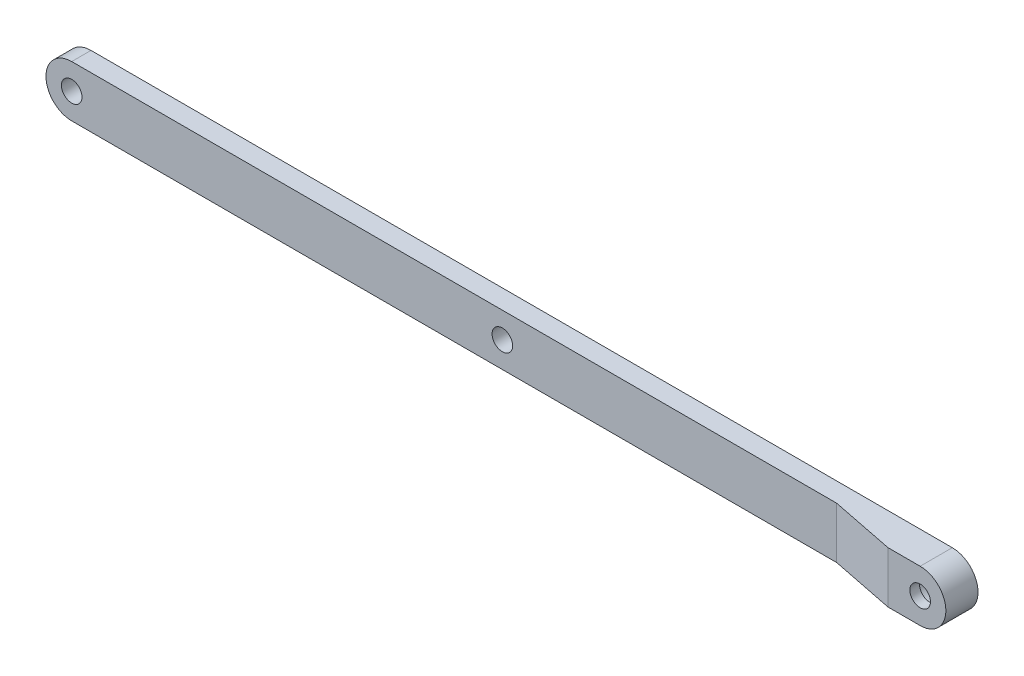
from build123d import *

# Parameters (mm, degrees)
SKETCH_1_R          = 2.75
SKETCH_1_R_2        = 1.6
EXTRUDE_1_DEPTH     = 5
EXTRUDE_START       = -1.5
SKETCH_2_R          = 2.75
SKETCH_2_R_2        = 1.6
EXTRUDE_2_DEPTH     = 1.5
SKETCH_3_W          = 127
SKETCH_3_H          = 8
CUT_EXTRUDE_1_DEPTH = 2
CHAMFER_1_SIZE2     = 2
CHAMFER_1_SIZE      = 10


with BuildPart() as part:
    # 草圖1 → 填料-伸長1 (new body)
    with BuildSketch(Plane.XY):
        with BuildLine():
            Line((-53.111291809, 4), (80.888708191, 4))
            ThreePointArc((80.888708191, 4), (84.888708191, 0), (80.888708191, -4))
            Line((80.888708191, -4), (-53.111291809, -4))
            ThreePointArc((-53.111291809, -4), (-57.111291809, 0), (-53.111291809, 4))
        make_face()
        with Locations((80.888708191, 0)):
            Circle(SKETCH_1_R, mode=Mode.SUBTRACT)
        with Locations((-53.111291809, 0)):
            Circle(SKETCH_1_R_2, mode=Mode.SUBTRACT)
        with Locations((13.888708191, 0)):
            Circle(SKETCH_1_R_2, mode=Mode.SUBTRACT)
    extrude(amount=EXTRUDE_1_DEPTH)

    # 草圖2 → 填料-伸長2 (add)
    with BuildSketch(Plane.XY.offset(5).offset(EXTRUDE_START)):
        with Locations((80.888708191, 0)):
            Circle(SKETCH_2_R)
        with Locations((80.888708191, 0)):
            Circle(SKETCH_2_R_2, mode=Mode.SUBTRACT)
    extrude(amount=EXTRUDE_2_DEPTH)

    # 草圖3 → 除料-伸長1 (cut)
    with BuildSketch(Plane.XY.offset(5)):
        with Locations((2.388708191, 0)):
            Rectangle(SKETCH_3_W, SKETCH_3_H)
    extrude(amount=-CUT_EXTRUDE_1_DEPTH, mode=Mode.SUBTRACT)

    # 導角1
    chamfer_1_edges = [part.edges().sort_by_distance(p)[0] for p in [
        (65.888708191, 0, 5),
    ]]
    chamfer_1_side = [part.faces().sort_by_distance(p)[0] for p in [
        (65.928708191, 0, 5),
    ]]
    chamfer(chamfer_1_edges, length=CHAMFER_1_SIZE - 0.0001, length2=CHAMFER_1_SIZE2 - 0.0001, reference=chamfer_1_side[0])  # a hair under: the kernel refuses the full size


solid = part.part
